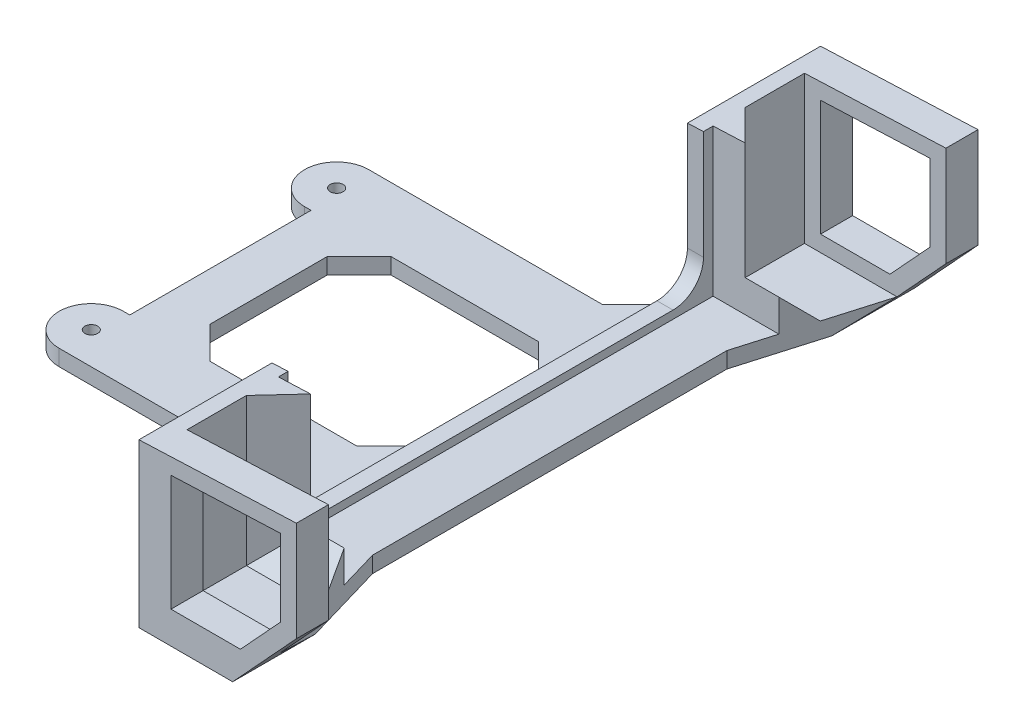
from build123d import *

# Parameters (mm, degrees)
BOSS_EXTRUDE1_DEPTH     = 10
BOSS_EXTRUDE6_DEPTH     = 41
CUT_EXTRUDE1_REACH      = 80.865
CUT_EXTRUDE2_REACH      = 80.865
BOSS_EXTRUDE9_DEPTH     = 10
CHAMFER3_SIZE           = 10
CUT_EXTRUDE3_DEPTH      = 77.842469388
CUT_EXTRUDE3_DEPTH_BACK = 77.842469388
BOSS_EXTRUDE10_DEPTH    = 55.25
SKETCH13_W              = 20
SKETCH13_H              = 5
BOSS_EXTRUDE11_DEPTH    = 92.85
CUT_EXTRUDE4_REACH      = 147.324
SKETCH14_R              = 2
SKETCH15_W              = 15
SKETCH15_H              = 5
BOSS_EXTRUDE12_DEPTH    = 28.25
FILLET1_R               = 10
CHAMFER4_SIZE           = 10


with BuildPart() as part:
    # Sketch2 → Boss-Extrude1 (new body)
    with BuildSketch(Plane.XY):
        Polygon((-5, -50.944473192), (-5, -0.20517252), (44.083730464, 1.808954014), (44.083730464, -29.38936641), (24.227900916, -50.944473192), align=None)
    extrude(amount=BOSS_EXTRUDE1_DEPTH)

    # Sketch2<5> → Boss-Extrude6 (add)
    with BuildSketch(Plane.XY):
        Polygon((-5, -0.20517252), (-5, -50.944473192), (24.227900916, -50.944473192), (28.833730464, -45.944473192), (0, -45.944473192), (0, 0), align=None)
    extrude(amount=-BOSS_EXTRUDE6_DEPTH)

    # Sketch6 → Cut-Extrude1 (cut, up to next)
    with BuildSketch(Plane(origin=(0, 0, 0), x_dir=(0, 0, -1), z_dir=(1, 0, 0)), mode=Mode.PRIVATE) as cut_extrude1_sk1:
        with BuildLine():
            Line((31.5, 0), (31.5, -33.944473192))
            ThreePointArc((31.5, -33.944473192), (47.717514421, -40.661987613), (41, -24.444473192))
            Line((41, -24.444473192), (41, 0))
            Line((41, 0), (31.5, 0))
        make_face()
    cut_extrude1_tool1 = extrude(cut_extrude1_sk1.sketch, amount=-CUT_EXTRUDE1_REACH, mode=Mode.PRIVATE) & part.part
    add(cut_extrude1_tool1.solids().sort_by_distance((0, -24.250765, -38.671635))[0], mode=Mode.SUBTRACT)

    # Sketch7 → Cut-Extrude2 (cut, up to next)
    with BuildSketch(Plane(origin=(0, 0, 0), x_dir=(-1, 0, 0), z_dir=(0, 0, -1)), mode=Mode.PRIVATE) as cut_extrude2_sk1:
        Polygon((-5, -4.799035286), (-39.083730464, -3.400426311), (-39.083730464, -27.437423368), (-26.641496625, -40.944473192), (-5, -40.944473192), align=None)
    cut_extrude2_tool1 = extrude(cut_extrude2_sk1.sketch, amount=-CUT_EXTRUDE2_REACH, mode=Mode.PRIVATE) & part.part
    add(cut_extrude2_tool1.solids().sort_by_distance((21.232744, -21.521517, 0))[0], mode=Mode.SUBTRACT)

    # Sketch10 → Boss-Extrude9 (add)
    with BuildSketch(Plane.XY.offset(-28.5)):
        Polygon((28.833730464, -45.944473192), (0, -45.944473192), (0, 0), (10, 0.41034504), (10, -35.944473192), (28.833730464, -35.944473192), align=None)
    extrude(amount=BOSS_EXTRUDE9_DEPTH)

    # Chamfer3
    chamfer3_edges = [part.edges().sort_by_distance(p)[0] for p in [
        (19.416865232, -35.944473192, -18.5),
        (10, -17.767064076, -18.5),
    ]]
    chamfer(chamfer3_edges, length=CHAMFER3_SIZE - 0.0001)  # a hair under: the kernel refuses the full size

    # Sketch11 → Cut-Extrude3 (cut, two sides: drawn at the far end of the back side and taken through both)
    with BuildSketch(Plane(origin=(0, -45.944473192, 0), x_dir=(1, 0, 0), z_dir=(0, 1, 0)).offset(-CUT_EXTRUDE3_DEPTH_BACK)):
        Polygon((28.833730464, 41), (16.833730464, 41), (28.833730464, 0), align=None)
    extrude(amount=CUT_EXTRUDE3_DEPTH + CUT_EXTRUDE3_DEPTH_BACK, mode=Mode.SUBTRACT)

    # Sketch12 → Boss-Extrude10 (add)
    with BuildSketch(Plane(origin=(0, 0, -41), x_dir=(-1, 0, 0), z_dir=(0, 0, -1))):
        Polygon((0, -45.944473192), (-16.833730464, -45.944473192), (-16.833730464, -50.944473192), (5, -50.944473192), (5, -43.444473192), (0, -43.444473192), align=None)
    extrude(amount=BOSS_EXTRUDE10_DEPTH)

    # Sketch13 → Boss-Extrude11 (add)
    with BuildSketch(Plane.ZY.offset(5)):
        with Locations((-58, -48.444473192)):
            Rectangle(SKETCH13_W, SKETCH13_H)
    extrude(amount=BOSS_EXTRUDE11_DEPTH)

    # Sketch14 → Cut-Extrude4 (cut, up to next)
    with BuildSketch(Plane(origin=(0, -45.944473192, 0), x_dir=(1, 0, 0), z_dir=(0, 1, 0)), mode=Mode.PRIVATE) as cut_extrude4_sk1:
        with Locations(Location((-87.85, 58, 0), (0, 0, 270))):
            Circle(SKETCH14_R)
    cut_extrude4_tool1 = extrude(cut_extrude4_sk1.sketch, amount=-CUT_EXTRUDE4_REACH, mode=Mode.PRIVATE) & part.part
    add(cut_extrude4_tool1.solids().sort_by_distance((-87.85, -45.944473, -58))[0], mode=Mode.SUBTRACT)

    # Sketch15 → Boss-Extrude12 (add)
    with BuildSketch(Plane(origin=(0, 0, -68), x_dir=(-1, 0, 0), z_dir=(0, 0, -1))):
        with Locations((78.35, -48.444473192)):
            Rectangle(SKETCH15_W, SKETCH15_H)
    extrude(amount=BOSS_EXTRUDE12_DEPTH)

    # Mirror1: part across plane


with BuildPart() as part_1:
    add(part.part)
    add(part.part.mirror(Plane(origin=(0, 0, -96.25), x_dir=(1, 0, 0), z_dir=(0, 0, -1))))

    # Fillet1
    fillet1_edges = [part_1.edges().sort_by_distance(p)[0] for p in [
        (-97.85, -48.444473192, -144.5),
        (-97.85, -48.444473192, -48),
        (-97.85, -48.444473192, -124.5),
        (-97.85, -48.444473192, -68),
    ]]
    fillet(fillet1_edges, radius=FILLET1_R - 0.0001)  # a hair under: the kernel refuses the full size

    # Chamfer4
    chamfer4_edges = [part_1.edges().sort_by_distance(p)[0] for p in [
        (-5, -48.444473192, -68),
        (-5, -48.444473192, -48),
        (-70.85, -48.444473192, -68),
        (-70.85, -48.444473192, -124.5),
        (-5, -48.444473192, -124.5),
        (-5, -48.444473192, -144.5),
    ]]
    chamfer(chamfer4_edges, length=CHAMFER4_SIZE)


solid = part_1.part
